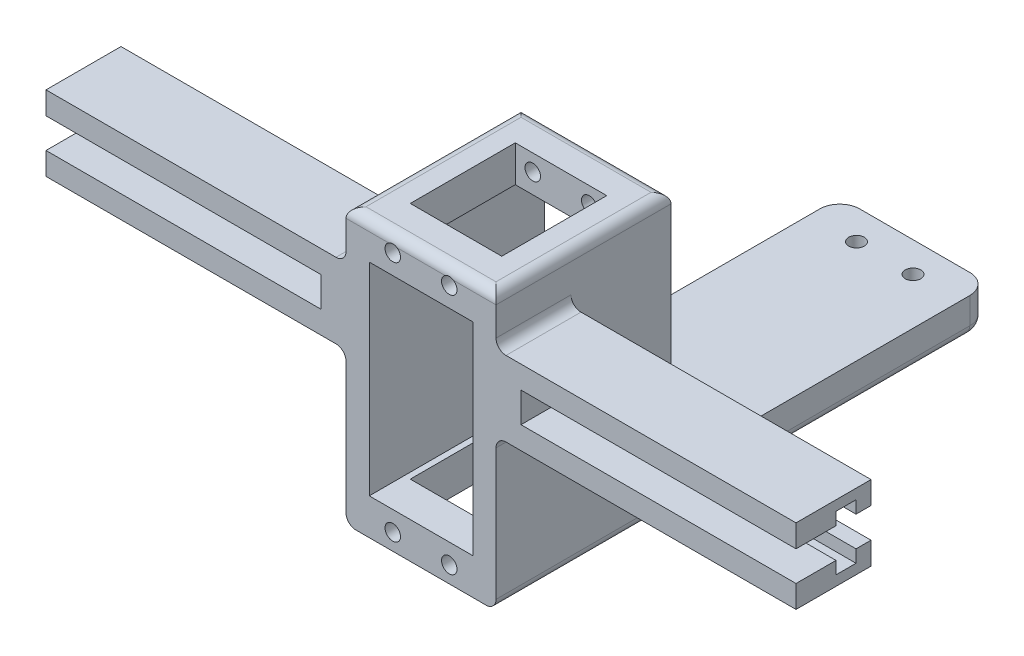
from build123d import *

# Parameters (mm, degrees)
SKETCH1_W           = 30
SKETCH1_H           = 55
SKETCH1_R           = 1.55
SKETCH1_W_2         = 20.7
SKETCH1_H_2         = 40.5
BOSS_EXTRUDE1_DEPTH = 35
SKETCH11_W          = 30
SKETCH11_H          = 7.25
BOSS_EXTRUDE5_DEPTH = 63.75
SKETCH12_R          = 1.55
CUT_EXTRUDE2_DEPTH  = 13
LPATTERN2_COUNT     = 2
LPATTERN2_PITCH     = 48
FILLET1_R           = 4
SKETCH13_W          = 60
SKETCH13_H          = 15
BOSS_EXTRUDE6_DEPTH = 15
CUT_EXTRUDE3_DEPTH  = 55
CUT_EXTRUDE4_DEPTH  = 55
SKETCH18_W          = 18.3
SKETCH18_H          = 21
CUT_EXTRUDE5_DEPTH  = 113.756651688
FILLET6_R           = 2
FILLET7_R           = 2
FILLET8_R           = 2


with BuildPart() as part:
    # Sketch1 → Boss-Extrude1 (new body)
    with BuildSketch(Plane.XY):
        Rectangle(SKETCH1_W, SKETCH1_H)
        with Locations((5.65, 24.2)):
            Circle(SKETCH1_R, mode=Mode.SUBTRACT)
        with Locations(Location((-5.65, 24.2, 0), (0, 0, 180))):
            Circle(SKETCH1_R, mode=Mode.SUBTRACT)
        with Locations((-5.65, -24.2)):
            Circle(SKETCH1_R, mode=Mode.SUBTRACT)
        with Locations(Location((5.65, -24.2, 0), (0, 0, 180))):
            Circle(SKETCH1_R, mode=Mode.SUBTRACT)
        Rectangle(SKETCH1_W_2, SKETCH1_H_2, mode=Mode.SUBTRACT)
    extrude(amount=BOSS_EXTRUDE1_DEPTH)

    # Sketch11 → Boss-Extrude5 (add)
    with BuildSketch(Plane(origin=(0, 0, 0), x_dir=(-1, 0, 0), z_dir=(0, 0, -1))):
        with Locations((0, -23.875)):
            Rectangle(SKETCH11_W, SKETCH11_H)
    extrude(amount=BOSS_EXTRUDE5_DEPTH)

    # Sketch12 → Cut-Extrude2 (cut)
    with BuildSketch(Plane.XZ.offset(27.5)):
        with Locations(Location((-5.65, -57.75, 0), (0, 0, 270))):
            Circle(SKETCH12_R)
        with Locations(Location((5.65, -57.75, 0), (0, 0, 270))):
            Circle(SKETCH12_R)
    cut_extrude2 = extrude(amount=-CUT_EXTRUDE2_DEPTH, mode=Mode.SUBTRACT)

    # LPattern2: Cut-Extrude2 ×2
    with Locations(*[(0, 0, i * LPATTERN2_PITCH) for i in range(1, LPATTERN2_COUNT)]):
        add(cut_extrude2, mode=Mode.SUBTRACT)

    # Fillet1
    fillet1_edges = [part.edges().sort_by_distance(p)[0] for p in [
        (12.675, -20.25, 0),
        (-12.675, -20.25, 0),
        (15, -23.875, -63.75),
        (-15, -23.875, -63.75),
    ]]
    fillet(fillet1_edges, radius=FILLET1_R)

    # Sketch13 → Boss-Extrude6 (add)
    with BuildSketch(Plane.XY.offset(35)):
        with Locations((-45, 10.25)):
            Rectangle(SKETCH13_W, SKETCH13_H)
        with Locations((45, 10.25)):
            Rectangle(SKETCH13_W, SKETCH13_H)
    extrude(amount=-BOSS_EXTRUDE6_DEPTH)

    # Sketch14 → Cut-Extrude3 (cut)
    with BuildSketch(Plane(origin=(75, 0, 0), x_dir=(0, 0, -1), z_dir=(1, 0, 0))):
        Polygon((-35, 13.25), (-35, 7.25), (-27, 7.25), (-27, 4.75), (-23, 4.75), (-23, 7.25), (-20, 7.25), (-20, 13.25), (-23, 13.25), (-23, 15.75), (-27, 15.75), (-27, 13.25), align=None)
    extrude(amount=-CUT_EXTRUDE3_DEPTH, mode=Mode.SUBTRACT)

    # Sketch17 → Cut-Extrude4 (cut)
    with BuildSketch(Plane.ZY.offset(75)):
        Polygon((35, 7.25), (35, 13.25), (27, 13.25), (27, 15.75), (23, 15.75), (23, 13.25), (20, 13.25), (20, 7.25), (23, 7.25), (23, 4.75), (27, 4.75), (27, 7.25), align=None)
    extrude(amount=-CUT_EXTRUDE4_DEPTH, mode=Mode.SUBTRACT)

    # Sketch18 → Cut-Extrude5 (cut, through all)
    with BuildSketch(Plane(origin=(0, 27.5, 0), x_dir=(1, 0, 0), z_dir=(0, 1, 0))):
        with Locations((0, -17.5)):
            Rectangle(SKETCH18_W, SKETCH18_H)
    extrude(amount=-CUT_EXTRUDE5_DEPTH, mode=Mode.SUBTRACT)

    # Fillet6
    # the kernel refuses this fillet: 2 mm, written as the material it adds along each edge
    with BuildSketch(Plane(origin=(-15, 17.75, 35), x_dir=(0, 1, 0), z_dir=(0, 0, -1))) as fillet6_piece_1:
        with BuildLine():
            CenterArc((FILLET6_R, -FILLET6_R), FILLET6_R, 90, 90)
            Line((0, -FILLET6_R), (0, 0))
            Line((0, 0), (FILLET6_R, 0))
        make_face()
    extrude(amount=15)
    with BuildSketch(Plane(origin=(15, 17.75, 35), x_dir=(0, 1, 0), z_dir=(0, 0, -1))) as fillet6_piece_2:
        with BuildLine():
            CenterArc((FILLET6_R, FILLET6_R), FILLET6_R, 180, 90)
            Line((0, FILLET6_R), (0, 0))
            Line((0, 0), (FILLET6_R, 0))
        make_face()
    extrude(amount=15)
    # the kernel refuses this fillet: 2 mm, written as the material it takes off along each edge
    with BuildSketch(Plane(origin=(-20, 27.5, 0), x_dir=(0, 0, 1), z_dir=(1, 0, 0))) as fillet6_2_piece_1:
        with BuildLine():
            CenterArc((FILLET6_R, FILLET6_R), FILLET6_R, 180, 90)
            Line((0, FILLET6_R), (0, 0))
            Line((0, 0), (FILLET6_R, 0))
        make_face()
    extrude(amount=40, mode=Mode.SUBTRACT)
    with BuildSketch(Plane(origin=(-15, 27.5, -5), x_dir=(0, -1, 0), z_dir=(0, 0, 1)), Plane(origin=(15, 27.5, -5), x_dir=(-1, 0, 0), z_dir=(0, 0, 1))) as fillet6_2_piece_2:
        with BuildLine():
            CenterArc((FILLET6_R, FILLET6_R), FILLET6_R, 180, 90)
            Line((0, FILLET6_R), (0, 0))
            Line((0, 0), (FILLET6_R, 0))
        make_face()
    extrude(amount=45, mode=Mode.SUBTRACT)
    with BuildSketch(Plane(origin=(-20, 27.5, 35), x_dir=(0, 0, -1), z_dir=(1, 0, 0))) as fillet6_2_piece_3:
        with BuildLine():
            CenterArc((FILLET6_R, -FILLET6_R), FILLET6_R, 90, 90)
            Line((0, -FILLET6_R), (0, 0))
            Line((0, 0), (FILLET6_R, 0))
        make_face()
    extrude(amount=40, mode=Mode.SUBTRACT)

    # Fillet7
    fillet7_edges = [part.edges().sort_by_distance(p)[0] for p in [
        (-15, 2.75, 27.5),
        (15, 2.75, 27.5),
    ]]
    fillet(fillet7_edges, radius=FILLET7_R)

    # Fillet8
    fillet8_edges = [part.edges().sort_by_distance(p)[0] for p in [
        (15, -27.5, -12.375),
        (-15, -27.5, -12.375),
        (0, -27.5, -63.75),
        (-13.828427125, -27.5, -62.578427125),
        (13.828427125, -27.5, -62.578427125),
    ]]
    fillet(fillet8_edges, radius=FILLET8_R)


solid = part.part
